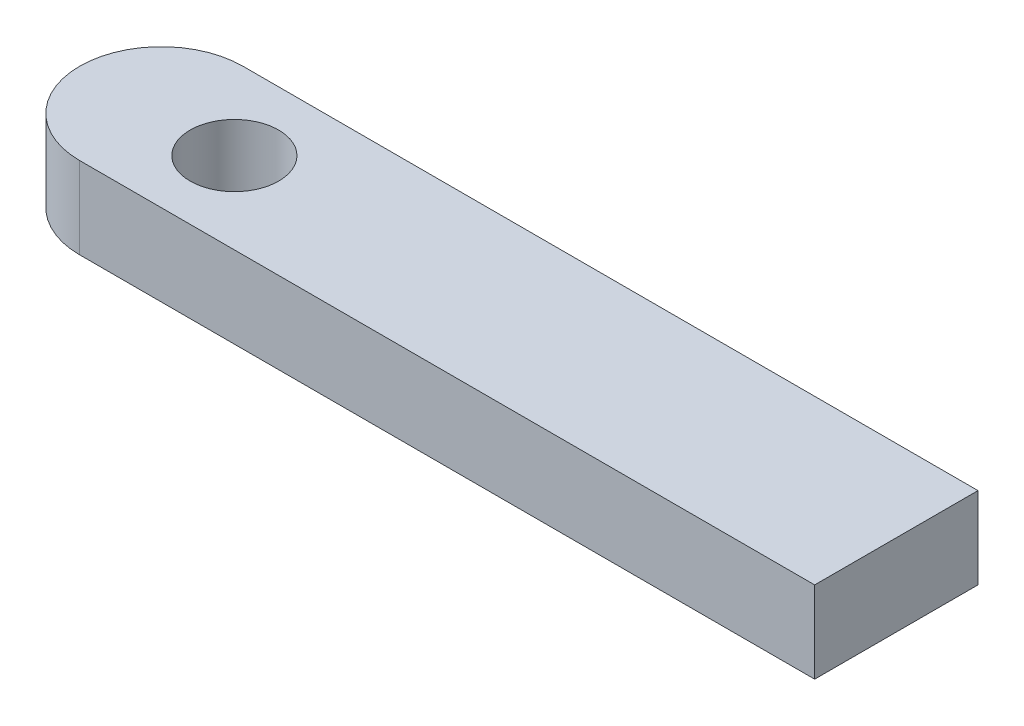
from build123d import *

# Parameters (mm, degrees)
SKETCH1_W           = 50
SKETCH1_H           = 10
SKETCH1_R           = 2.709740506
BOSS_EXTRUDE2_DEPTH = 5
FILLET1_R           = 5


with BuildPart() as part:
    # Sketch1 → Boss-Extrude2 (new body)
    with BuildSketch(Plane(origin=(0, 0, 0), x_dir=(1, 0, 0), z_dir=(0, 1, 0))):
        Rectangle(SKETCH1_W, SKETCH1_H)
        with Locations(Location((-15.524592929, 0, 0), (0, 0, 270))):
            Circle(SKETCH1_R, mode=Mode.SUBTRACT)
    extrude(amount=BOSS_EXTRUDE2_DEPTH)

    # Fillet1
    fillet1_edges = [part.edges().sort_by_distance(p)[0] for p in [
        (-25, 2.5, -5),
        (-25, 2.5, 5),
    ]]
    fillet(fillet1_edges, radius=FILLET1_R - 0.0001)  # a hair under: the kernel refuses the full size


solid = part.part
